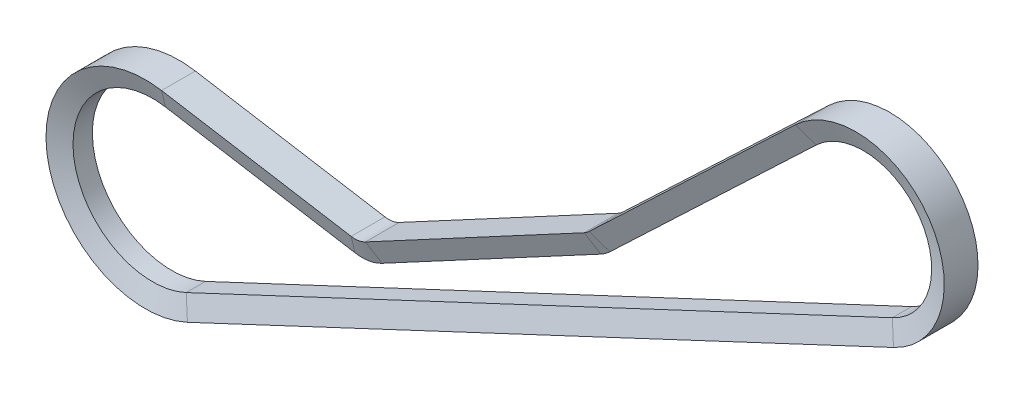
from build123d import *


with BuildPart() as part:
    # Sweep1: sweep along a path in Sketch2
    with BuildLine(Plane.XY) as sweep1_path:
        Line((10.564484517, -22.520153054), (-188.58863364, -115.94536327))
        ThreePointArc((-188.58863364, -115.94536327), (-228.218248113, -94.417962257), (-195.887195508, -62.975341896))
        Line((-195.887195508, -62.975341896), (-142.407445321, -71.868629759))
        ThreePointArc((-142.407445321, -71.868629759), (-140.330634999, -71.869706751), (-138.364551376, -71.200634664))
        Line((-138.364551376, -71.200634664), (-76.676518344, -38.116097782))
        ThreePointArc((-76.676518344, -38.116097782), (-75.959571066, -37.667692175), (-75.308562288, -37.127999154))
        Line((-75.308562288, -37.127999154), (-17.115552016, 18.050581871))
        ThreePointArc((-17.115552016, 18.050581871), (20.54812046, 14.019285726), (10.564484517, -22.520153054))
    # Sketch3 → Sweep1 (sweep)
    with BuildSketch(Plane(origin=(-17.115552016, 18.050581871, 0), x_dir=(0.6880623916753041, -0.7256515314957038, 0), z_dir=(0.7256515314957038, 0.6880623916753041, 0))):
        Polygon((0, -4.7625), (0, 4.7625), (5.588, 2.728634331), (5.588, -2.728634331), align=None)
    sweep(path=sweep1_path.line)


solid = part.part
